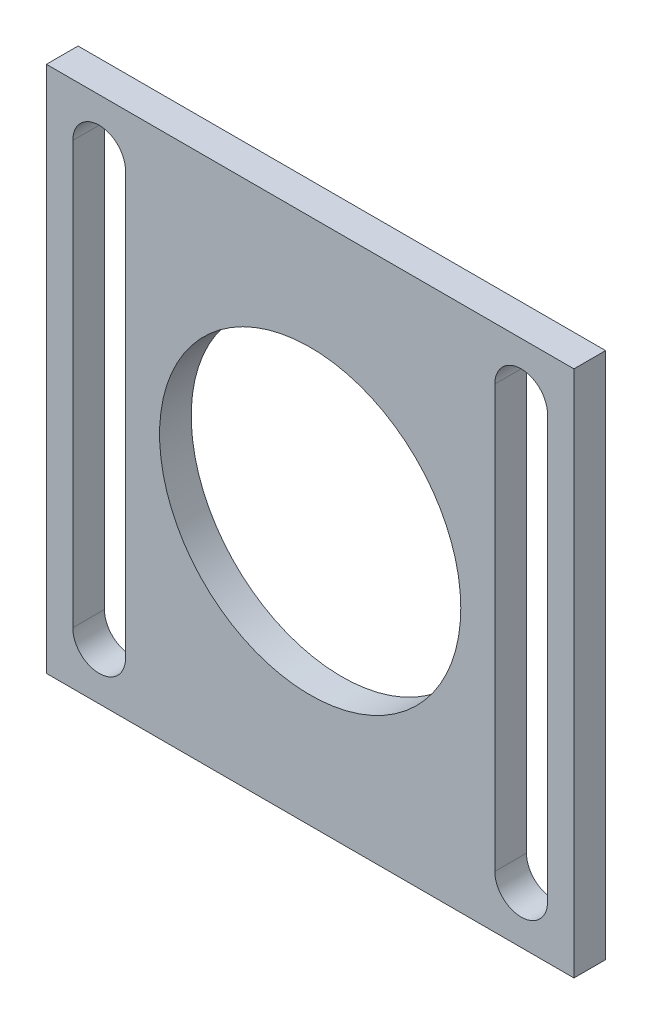
from build123d import *

# Parameters (mm, degrees)
SKETCH1_W           = 50
SKETCH1_H           = 50
BOSS_EXTRUDE1_DEPTH = 3
SKETCH2_R           = 14.275
CUT_EXTRUDE1_DEPTH  = 3


with BuildPart() as part:
    # Sketch1 → Boss-Extrude1 (new body)
    with BuildSketch(Plane.XY):
        with Locations((25, 25)):
            Rectangle(SKETCH1_W, SKETCH1_H)
    extrude(amount=BOSS_EXTRUDE1_DEPTH)

    # Sketch2 → Cut-Extrude1 (cut)
    with BuildSketch(Plane.XY.offset(3)):
        with Locations((25, 25)):
            Circle(SKETCH2_R)
        with BuildLine():
            Line((7.5, 45), (7.5, 5))
            ThreePointArc((7.5, 5), (5, 2.5), (2.5, 5))
            Line((2.5, 5), (2.5, 45))
            ThreePointArc((2.5, 45), (5, 47.5), (7.5, 45))
        make_face()
        with BuildLine():
            Line((47.5, 45), (47.5, 5))
            ThreePointArc((47.5, 5), (45, 2.5), (42.5, 5))
            Line((42.5, 5), (42.5, 45))
            ThreePointArc((42.5, 45), (45, 47.5), (47.5, 45))
        make_face()
    extrude(amount=-CUT_EXTRUDE1_DEPTH, mode=Mode.SUBTRACT)


solid = part.part
